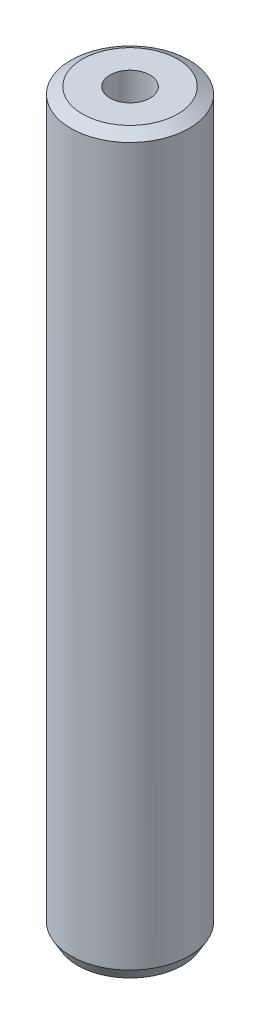
from build123d import *
from OCP.BRepFilletAPI import BRepFilletAPI_MakeChamfer

# Parameters (mm, degrees)
SKETCH1_R           = 37.5
BOSS_EXTRUDE1_DEPTH = 465.942837783
SKETCH2_R           = 12.695700965
CUT_EXTRUDE1_DEPTH  = 469.951200107
CHAMFER1_SIZE       = 4.225973652
CHAMFER1_SIZE2      = 7.319601077


with BuildPart() as part:
    # Sketch1 → Boss-Extrude1 (new body)
    with BuildSketch(Plane(origin=(0, 0, 0), x_dir=(1, 0, 0), z_dir=(0, 1, 0))):
        Circle(SKETCH1_R)
    extrude(amount=BOSS_EXTRUDE1_DEPTH)

    # Sketch2 → Cut-Extrude1 (cut, through all)
    with BuildSketch(Plane(origin=(0, 0, 0), x_dir=(1, 0, 0), z_dir=(0, 1, 0))):
        Circle(SKETCH2_R)
    extrude(amount=CUT_EXTRUDE1_DEPTH, mode=Mode.SUBTRACT)

    # Chamfer1: one chamfer whose edges measure the first distance from different faces: ONE call of the kernel's chamfer builder (chamfer() names one face for all edges)
    chamfer1_edges_1 = [part.edges().sort_by_distance(p)[0] for p in [
        (-37.5, 465.942837783, 0),
    ]]
    chamfer1_side_1 = [part.faces().sort_by_distance(p)[0] for p in [
        (-37.5, 232.971418892, 0),
    ]]
    chamfer1_edges_2 = [part.edges().sort_by_distance(p)[0] for p in [
        (-37.5, 0, 0),
    ]]
    chamfer1_side_2 = [part.faces().sort_by_distance(p)[0] for p in [
        (-36.439339828, 0, 0),
    ]]
    chamfer1 = BRepFilletAPI_MakeChamfer(part.part.solid().wrapped)
    for e in chamfer1_edges_1:
        chamfer1.Add(CHAMFER1_SIZE, CHAMFER1_SIZE2, e.wrapped, chamfer1_side_1[0].wrapped)  # the first distance lies on this face
    for e in chamfer1_edges_2:
        chamfer1.Add(CHAMFER1_SIZE, CHAMFER1_SIZE2, e.wrapped, chamfer1_side_2[0].wrapped)  # the first distance lies on this face
    add(Compound.cast(chamfer1.Shape()), mode=Mode.REPLACE)


solid = part.part
